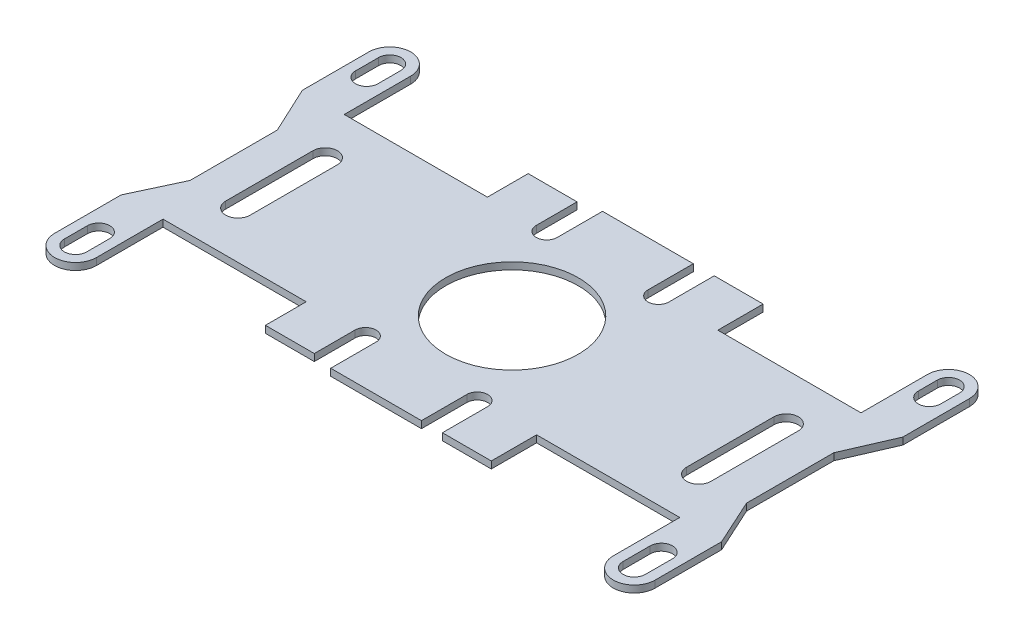
from build123d import *

# Parameters (mm, degrees)
SKETCH1_R                 = 9.5
BASE_FLANGE1_DEPTH        = 1
EDGE_FLANGE1_DEPTH        = 25.955542515
EDGE_FLANGE1_BEND_DEPTH   = 25.955542515
CUT_EXTRUDE1_DEPTH        = 54.438514327
CUT_EXTRUDE1_DEPTH_BACK   = 54.438514327
BOSS_EXTRUDE1_DEPTH       = 1
BOSS_EXTRUDE2_START       = -23.9366
BOSS_EXTRUDE2_DEPTH       = 47.8732
BOSS_EXTRUDE2_START_2     = -31.255846738
BOSS_EXTRUDE2_2_OUTLINE_W = 1
BOSS_EXTRUDE2_2_OUTLINE_H = 25.955542514
BOSS_EXTRUDE2_2_DEPTH     = 14.755846738
BOSS_EXTRUDE2_START_3     = 16.5
BOSS_EXTRUDE2_3_OUTLINE_W = 1
BOSS_EXTRUDE2_3_OUTLINE_H = 25.955542514
BOSS_EXTRUDE2_3_DEPTH     = 14.755846738
BOSS_EXTRUDE2_START_4     = 34.755846738
BOSS_EXTRUDE2_4_OUTLINE_W = 1
BOSS_EXTRUDE2_4_OUTLINE_H = 25.955542514
BOSS_EXTRUDE2_4_DEPTH     = 5.25
BOSS_EXTRUDE2_START_5     = -39.865847056
BOSS_EXTRUDE2_5_OUTLINE_W = 1
BOSS_EXTRUDE2_5_OUTLINE_H = 25.955542514
BOSS_EXTRUDE2_5_DEPTH     = 5.110000318
BOSS_EXTRUDE2_6_DEPTH     = 1


with BuildPart() as part:
    # Base-Flange1: sheet metal written as solids
    # Sketch1 → Base-Flange1 (new body)
    with BuildSketch(Plane(origin=(0, 0, 0), x_dir=(1, 0, 0), z_dir=(0, 1, 0))):
        with BuildLine():
            Line((-22.2, -12.977771257), (-22.2, 12.977771257))
            Line((-22.2, 12.977771257), (-16.5, 12.977771257))
            Line((-16.5, 12.977771257), (-16.5, 18.815937518))
            Line((-16.5, 18.815937518), (-9.5, 18.815937518))
            Line((-9.5, 18.815937518), (-9.5, 12.977771257))
            ThreePointArc((-9.5, 12.977771257), (-8, 11.477771257), (-6.5, 12.977771257))
            Line((-6.5, 12.977771257), (-6.5, 19.464622659))
            Line((-6.5, 19.464622659), (6.5, 19.464622659))
            Line((6.5, 19.464622659), (6.5, 12.977771257))
            ThreePointArc((6.5, 12.977771257), (8, 11.477771257), (9.5, 12.977771257))
            Line((9.5, 12.977771257), (9.5, 19.464622659))
            Line((9.5, 19.464622659), (16.5, 19.464622659))
            Line((16.5, 19.464622659), (16.5, 12.977771257))
            Line((16.5, 12.977771257), (22.2, 12.977771257))
            Line((22.2, 12.977771257), (22.2, -12.977771257))
            Line((22.2, -12.977771257), (16.5, -12.977771257))
            Line((16.5, -12.977771257), (16.5, -19.464622659))
            Line((16.5, -19.464622659), (9.5, -19.464622659))
            Line((9.5, -19.464622659), (9.5, -12.977771257))
            ThreePointArc((9.5, -12.977771257), (8, -11.477771257), (6.5, -12.977771257))
            Line((6.5, -12.977771257), (6.5, -19.464622659))
            Line((6.5, -19.464622659), (-6.5, -19.464622659))
            Line((-6.5, -19.464622659), (-6.5, -12.977771257))
            ThreePointArc((-6.5, -12.977771257), (-8, -11.477771257), (-9.5, -12.977771257))
            Line((-9.5, -12.977771257), (-9.5, -18.815937518))
            Line((-9.5, -18.815937518), (-16.5, -18.815937518))
            Line((-16.5, -18.815937518), (-16.5, -12.977771257))
            Line((-16.5, -12.977771257), (-22.2, -12.977771257))
        make_face()
        with Locations(Location((0, 0, 0), (0, 0, 270))):
            Circle(SKETCH1_R, mode=Mode.SUBTRACT)
    extrude(amount=BASE_FLANGE1_DEPTH)

    # Edge-Flange1: sheet metal written as solids
    # Edge-Flange1 section (on a plane across the edge) → Edge-Flange1 (add)
    with BuildSketch(Plane(origin=(22.9366, 0, -12.977771257), x_dir=(-1, 0, 0), z_dir=(0, 0, 1))):
        with BuildLine():
            Line((-1, 0.7366), (-1, 13.6))
            Line((-1, 13.6), (0, 13.6))
            Line((0, 13.6), (0, 0.7366))
            ThreePointArc((0, 0.7366), (0.215745145, 0.215745145), (0.7366, 0))
            Line((0.7366, 0), (0.7366, -1))
            ThreePointArc((0.7366, -1), (-0.491361636, -0.491361636), (-1, 0.7366))
        make_face()
    extrude(amount=EDGE_FLANGE1_DEPTH)

    # Edge-Flange1 section 2 (on a plane across the edge) → Edge-Flange1 bend (add)
    with BuildSketch(Plane(origin=(-22.9366, 0, 12.977771257), x_dir=(1, 0, 0), z_dir=(0, 0, -1))):
        with BuildLine():
            Line((-1, 0.7366), (-1, 13.6))
            Line((-1, 13.6), (0, 13.6))
            Line((0, 13.6), (0, 0.7366))
            ThreePointArc((0, 0.7366), (0.215745145, 0.215745145), (0.7366, 0))
            Line((0.7366, 0), (0.7366, -1))
            ThreePointArc((0.7366, -1), (-0.491361636, -0.491361636), (-1, 0.7366))
        make_face()
    extrude(amount=EDGE_FLANGE1_BEND_DEPTH)

    # Sketch16 → Cut-Extrude1 (cut, two sides: drawn at the far end of the back side and taken through both)
    with BuildSketch(Plane(origin=(23.9366, 0, 0), x_dir=(0, 0, -1), z_dir=(1, 0, 0)).offset(-CUT_EXTRUDE1_DEPTH_BACK)):
        with BuildLine():
            Line((-6.25, -7.85), (6.25, -7.85))
            ThreePointArc((6.25, -7.85), (8, -9.6), (6.25, -11.35))
            Line((6.25, -11.35), (-6.25, -11.35))
            ThreePointArc((-6.25, -11.35), (-8, -9.6), (-6.25, -7.85))
        make_face()
    extrude(amount=CUT_EXTRUDE1_DEPTH + CUT_EXTRUDE1_DEPTH_BACK, mode=Mode.SUBTRACT)

    # Sketch17 → Boss-Extrude1 (add)
    with BuildSketch(Plane(origin=(23.9366, 0, 0), x_dir=(0, 0, -1), z_dir=(1, 0, 0))):
        with BuildLine():
            Line((12.977771257, -19.6), (22.5, -19.6))
            ThreePointArc((22.5, -19.6), (25.5, -16.6), (22.5, -13.6))
            Line((22.5, -13.6), (12.977771257, -13.6))
            Line((12.977771257, -13.6), (-12.977771257, -13.6))
            Line((-12.977771257, -13.6), (-22.5, -13.6))
            ThreePointArc((-22.5, -13.6), (-25.5, -16.6), (-22.5, -19.6))
            Line((-22.5, -19.6), (-12.977771257, -19.6))
            Line((-12.977771257, -19.6), (-6.418417428, -16.6))
            Line((-6.418417428, -16.6), (6.081582572, -16.6))
            Line((6.081582572, -16.6), (12.977771257, -19.6))
        make_face()
        with BuildLine():
            ThreePointArc((19.786671521, -15), (18.186671521, -16.6), (19.786671521, -18.2))
            Line((19.786671521, -18.2), (22.5, -18.2))
            ThreePointArc((22.5, -18.2), (24.1, -16.6), (22.5, -15))
            Line((22.5, -15), (19.786671521, -15))
        make_face(mode=Mode.SUBTRACT)
        with BuildLine():
            ThreePointArc((-18.613328479, -18.2), (-17.013328479, -16.6), (-18.613328479, -15))
            Line((-18.613328479, -15), (-22.5, -15))
            ThreePointArc((-22.5, -15), (-24.1, -16.6), (-22.5, -18.2))
            Line((-22.5, -18.2), (-18.613328479, -18.2))
        make_face(mode=Mode.SUBTRACT)
    extrude(amount=-BOSS_EXTRUDE1_DEPTH)

    # Boss-Extrude2: read off the stored shape, not the designer's step
    # Boss-Extrude2 outline → Boss-Extrude2 (cut)
    with BuildSketch(Plane.YZ.offset(BOSS_EXTRUDE2_START)):
        with BuildLine():
            Line((0, -12.977771257), (0, 12.977771257))
            Line((0, 12.977771257), (-13.6, 12.977771257))
            Line((-13.6, 12.977771257), (-13.6, 22.5))
            ThreePointArc((-13.6, 22.5), (-16.6, 25.5), (-19.6, 22.5))
            Line((-19.6, 22.5), (-19.6, 12.977771257))
            Line((-19.6, 12.977771257), (-16.6, 6.418417428))
            Line((-16.6, 6.418417428), (-16.6, -6.081582572))
            Line((-16.6, -6.081582572), (-19.6, -12.977771257))
            Line((-19.6, -12.977771257), (-19.6, -22.5))
            ThreePointArc((-19.6, -22.5), (-16.6, -25.5), (-13.6, -22.5))
            Line((-13.6, -22.5), (-13.6, -12.977771257))
            Line((-13.6, -12.977771257), (0, -12.977771257))
        make_face()
        with BuildLine():
            Line((-11.35, -6.25), (-11.35, 6.25))
            ThreePointArc((-11.35, 6.25), (-9.6, 8), (-7.85, 6.25))
            Line((-7.85, 6.25), (-7.85, -6.25))
            ThreePointArc((-7.85, -6.25), (-9.6, -8), (-11.35, -6.25))
        make_face(mode=Mode.SUBTRACT)
        with BuildLine():
            Line((-18.2, 18.613328479), (-18.2, 22.5))
            ThreePointArc((-18.2, 22.5), (-16.6, 24.1), (-15, 22.5))
            Line((-15, 22.5), (-15, 18.613328479))
            ThreePointArc((-15, 18.613328479), (-16.6, 17.013328479), (-18.2, 18.613328479))
        make_face(mode=Mode.SUBTRACT)
        with BuildLine():
            Line((-15, -19.786671521), (-15, -22.5))
            ThreePointArc((-15, -22.5), (-16.6, -24.1), (-18.2, -22.5))
            Line((-18.2, -22.5), (-18.2, -19.786671521))
            ThreePointArc((-18.2, -19.786671521), (-16.6, -18.186671521), (-15, -19.786671521))
        make_face(mode=Mode.SUBTRACT)
    extrude(amount=BOSS_EXTRUDE2_DEPTH, mode=Mode.SUBTRACT)

    # Boss-Extrude2 2 outline → Boss-Extrude2 2 (add)
    with BuildSketch(Plane.YZ.offset(BOSS_EXTRUDE2_START_2)):
        with Locations((0.5, 0)):
            Rectangle(BOSS_EXTRUDE2_2_OUTLINE_W, BOSS_EXTRUDE2_2_OUTLINE_H)
    extrude(amount=BOSS_EXTRUDE2_2_DEPTH)

    # Boss-Extrude2 3 outline → Boss-Extrude2 3 (add)
    with BuildSketch(Plane.YZ.offset(BOSS_EXTRUDE2_START_3)):
        with Locations((0.5, 0)):
            Rectangle(BOSS_EXTRUDE2_3_OUTLINE_W, BOSS_EXTRUDE2_3_OUTLINE_H)
    extrude(amount=BOSS_EXTRUDE2_3_DEPTH)



with BuildPart() as body_2:
    # Boss-Extrude2 4 outline → Boss-Extrude2 4 (new body)
    with BuildSketch(Plane.YZ.offset(BOSS_EXTRUDE2_START_4)):
        with Locations((0.5, 0)):
            Rectangle(BOSS_EXTRUDE2_4_OUTLINE_W, BOSS_EXTRUDE2_4_OUTLINE_H)
    extrude(amount=BOSS_EXTRUDE2_4_DEPTH)


with BuildPart() as body_3:
    # Boss-Extrude2 5 outline → Boss-Extrude2 5 (new body)
    with BuildSketch(Plane.YZ.offset(BOSS_EXTRUDE2_START_5)):
        with Locations((0.5, 0)):
            Rectangle(BOSS_EXTRUDE2_5_OUTLINE_W, BOSS_EXTRUDE2_5_OUTLINE_H)
    extrude(amount=BOSS_EXTRUDE2_5_DEPTH)


with BuildPart() as part_1:
    add(part.part)

    add(body_2.part)  # Boss-Extrude2 6 merges body 2

    add(body_3.part)  # Boss-Extrude2 6 merges body 3
    # Boss-Extrude2 6 outline → Boss-Extrude2 6 (add)
    # profile 1 of 8: a face of its own
    with BuildSketch(Plane(origin=(0, 0, 0), x_dir=(1, 0, 0), z_dir=(0, 1, 0))):
        with BuildLine():
            Line((-34.755846738, 12.977771257), (-34.755846738, 6.25))
            ThreePointArc((-34.755846738, 6.25), (-33.005846738, 8), (-31.255846738, 6.25))
            Line((-31.255846738, 6.25), (-31.255846738, 12.977771257))
            Line((-31.255846738, 12.977771257), (-34.755846738, 12.977771257))
        make_face()
    # profile 2 of 8: a face of its own
    with BuildSketch(Plane(origin=(0, 0, 0), x_dir=(1, 0, 0), z_dir=(0, 1, 0))):
        with BuildLine():
            ThreePointArc((-31.255846738, -6.25), (-33.005846738, -8), (-34.755846738, -6.25))
            Line((-34.755846738, -6.25), (-34.755846738, -12.977771257))
            Line((-34.755846738, -12.977771257), (-31.255846738, -12.977771257))
            Line((-31.255846738, -12.977771257), (-31.255846738, -6.25))
        make_face()
    # profile 3 of 8: a face of its own
    with BuildSketch(Plane(origin=(0, 0, 0), x_dir=(1, 0, 0), z_dir=(0, 1, 0))):
        with BuildLine():
            Line((-39.865847056, 12.977771257), (-37.005846146, 12.977771257))
            Line((-37.005846146, 12.977771257), (-37.005847056, 22.5000001))
            ThreePointArc((-37.005847056, 22.5000001), (-40.005847106, 25.5), (-43.005847056, 22.5))
            Line((-43.005847056, 22.5), (-43.005847056, 12.977771257))
            Line((-43.005847056, 12.977771257), (-39.865847056, 6.25))
            Line((-39.865847056, 6.25), (-39.865847056, 12.977771257))
        make_face()
        with BuildLine():
            ThreePointArc((-38.405847056, 19.2), (-40.005847056, 17.6), (-41.605847056, 19.2))
            Line((-41.605847056, 19.2), (-41.605847056, 22.5))
            ThreePointArc((-41.605847056, 22.5), (-40.005847056, 24.1), (-38.405847056, 22.5))
            Line((-38.405847056, 22.5), (-38.405847056, 19.2))
        make_face(mode=Mode.SUBTRACT)
    # profile 4 of 8: a face of its own
    with BuildSketch(Plane(origin=(0, 0, 0), x_dir=(1, 0, 0), z_dir=(0, 1, 0))):
        with BuildLine():
            Line((-37.005846304, -22.4999999), (-37.005845553, -12.977771257))
            Line((-37.005845553, -12.977771257), (-39.865847056, -12.977771257))
            Line((-39.865847056, -12.977771257), (-39.865847056, -6.25))
            Line((-39.865847056, -6.25), (-43.005847056, -12.977771257))
            Line((-43.005847056, -12.977771257), (-43.005847807, -22.5))
            ThreePointArc((-43.005847807, -22.5), (-40.005847005, -25.500000751), (-37.005846304, -22.4999999))
        make_face()
        with BuildLine():
            Line((-38.405847056, -19.2), (-38.405847056, -22.5))
            ThreePointArc((-38.405847056, -22.5), (-40.005847056, -24.1), (-41.605847056, -22.5))
            Line((-41.605847056, -22.5), (-41.605847056, -19.2))
            ThreePointArc((-41.605847056, -19.2), (-40.005847056, -17.6), (-38.405847056, -19.2))
        make_face(mode=Mode.SUBTRACT)
    # profile 5 of 8: a face of its own
    with BuildSketch(Plane(origin=(0, 0, 0), x_dir=(1, 0, 0), z_dir=(0, 1, 0))):
        with BuildLine():
            ThreePointArc((43.005846738, 22.5), (40.005846738, 25.5), (37.005846738, 22.5))
            Line((37.005846738, 22.5), (37.005846738, 12.977771257))
            Line((37.005846738, 12.977771257), (40.005846738, 12.977771257))
            Line((40.005846738, 12.977771257), (40.005846738, 6.081582572))
            Line((40.005846738, 6.081582572), (43.005846738, 12.977771257))
            Line((43.005846738, 12.977771257), (43.005846738, 22.5))
        make_face()
        with BuildLine():
            Line((38.405846738, 19.786671521), (38.405846738, 22.5))
            ThreePointArc((38.405846738, 22.5), (40.005846738, 24.1), (41.605846738, 22.5))
            Line((41.605846738, 22.5), (41.605846738, 19.786671521))
            ThreePointArc((41.605846738, 19.786671521), (40.005846738, 18.186671521), (38.405846738, 19.786671521))
        make_face(mode=Mode.SUBTRACT)
    # profile 6 of 8: a face of its own
    with BuildSketch(Plane(origin=(0, 0, 0), x_dir=(1, 0, 0), z_dir=(0, 1, 0))):
        with BuildLine():
            Line((34.755846738, 6.25), (34.755846738, 12.977771257))
            Line((34.755846738, 12.977771257), (31.255846738, 12.977771257))
            Line((31.255846738, 12.977771257), (31.255846738, 6.25))
            ThreePointArc((31.255846738, 6.25), (33.005846738, 8), (34.755846738, 6.25))
        make_face()
    # profile 7 of 8: a face of its own
    with BuildSketch(Plane(origin=(0, 0, 0), x_dir=(1, 0, 0), z_dir=(0, 1, 0))):
        with BuildLine():
            Line((34.755846738, -12.977771257), (34.755846738, -6.25))
            ThreePointArc((34.755846738, -6.25), (33.005846738, -8), (31.255846738, -6.25))
            Line((31.255846738, -6.25), (31.255846738, -12.977771257))
            Line((31.255846738, -12.977771257), (34.755846738, -12.977771257))
        make_face()
    # profile 8 of 8: a face of its own
    with BuildSketch(Plane(origin=(0, 0, 0), x_dir=(1, 0, 0), z_dir=(0, 1, 0))):
        with BuildLine():
            Line((43.005846738, -12.977771257), (40.005846738, -6.418417428))
            Line((40.005846738, -6.418417428), (40.005846738, -12.977771257))
            Line((40.005846738, -12.977771257), (37.005846738, -12.977771257))
            Line((37.005846738, -12.977771257), (37.005846738, -22.5))
            ThreePointArc((37.005846738, -22.5), (40.005846738, -25.5), (43.005846738, -22.5))
            Line((43.005846738, -22.5), (43.005846738, -12.977771257))
        make_face()
        with BuildLine():
            ThreePointArc((41.605846738, -22.5), (40.005846738, -24.1), (38.405846738, -22.5))
            Line((38.405846738, -22.5), (38.405846738, -18.613328479))
            ThreePointArc((38.405846738, -18.613328479), (40.005846738, -17.013328479), (41.605846738, -18.613328479))
            Line((41.605846738, -18.613328479), (41.605846738, -22.5))
        make_face(mode=Mode.SUBTRACT)
    extrude(amount=BOSS_EXTRUDE2_6_DEPTH)


solid = part_1.part
